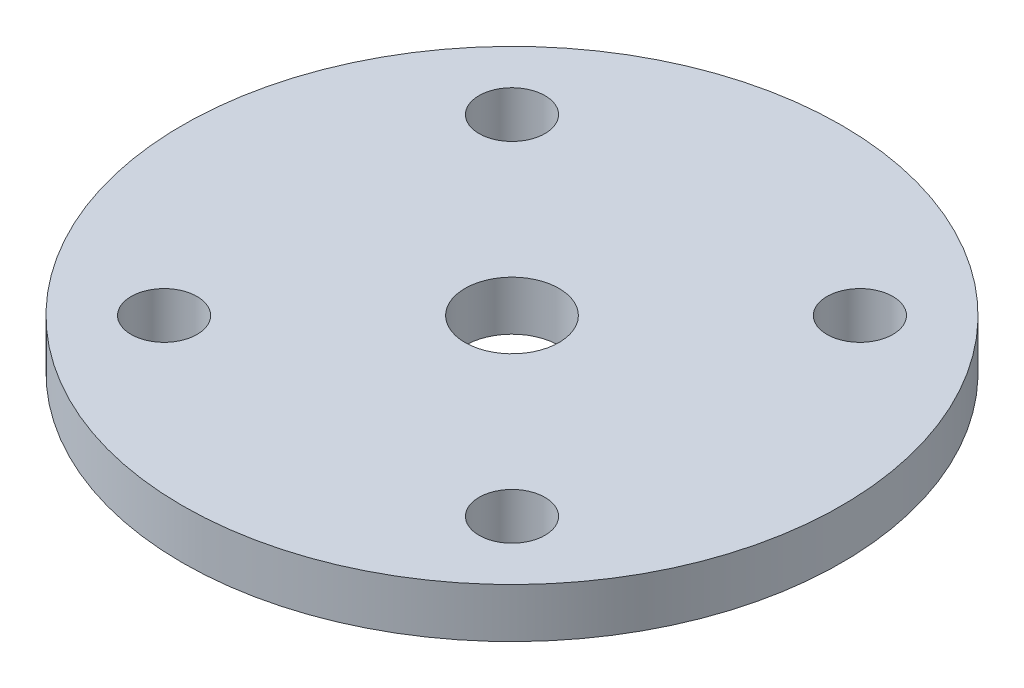
from build123d import *

# Parameters (mm, degrees)
ESBO_O1_R                = 20
ESBO_O1_R_2              = 2.85
ESBO_O1_R_3              = 2
RESSALTO_EXTRUS_O1_DEPTH = 3


with BuildPart() as part:
    # Esboço1 → Ressalto-extrusão1 (new body)
    with BuildSketch(Plane.XZ.offset(3)):
        Circle(ESBO_O1_R)
        Circle(ESBO_O1_R_2, mode=Mode.SUBTRACT)
        with Locations((10.557104243, 10.557104243)):
            Circle(ESBO_O1_R_3, mode=Mode.SUBTRACT)
        with Locations((10.557104243, -10.557104243)):
            Circle(ESBO_O1_R_3, mode=Mode.SUBTRACT)
        with Locations((-10.557104243, -10.557104243)):
            Circle(ESBO_O1_R_3, mode=Mode.SUBTRACT)
        with Locations((-10.557104243, 10.557104243)):
            Circle(ESBO_O1_R_3, mode=Mode.SUBTRACT)
    extrude(amount=-RESSALTO_EXTRUS_O1_DEPTH)


solid = part.part
